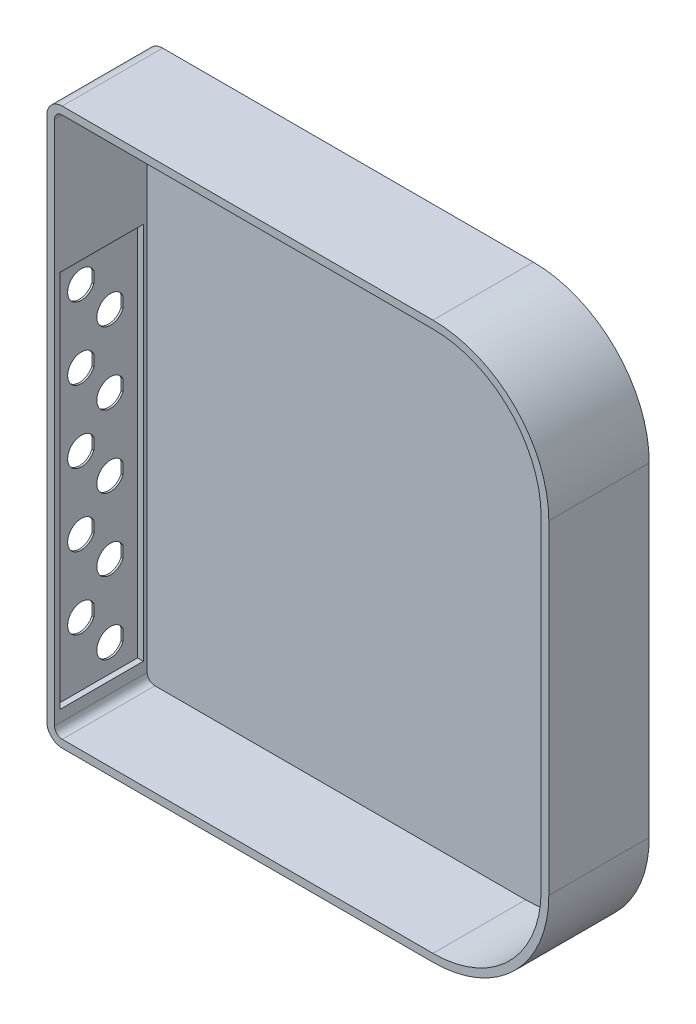
from build123d import *

# Parameters (mm, degrees)
BOSS_EXTRUDE1_DEPTH = 65
SHELL1_T            = -5
CUT_EXTRUDE1_DEPTH  = 373.86056375
SKETCH4_W           = 245
SKETCH4_H           = 53.856180832
CUT_EXTRUDE2_DEPTH  = 3.75


# Read off the part's stored shape, not the designer's step: Boss-Extrude1
with BuildPart() as part:
    # Boss-Extrude1 outline → Boss-Extrude1 (new body)
    with BuildSketch(Plane(origin=(0, 0, 0), x_dir=(0, 1, 0), z_dir=(0, 0, 1))):
        with BuildLine():
            ThreePointArc((105, -162.5), (158.033008589, -140.533008589), (180, -87.5))
            Line((180, -87.5), (180, 152.5))
            ThreePointArc((180, 152.5), (177.071067812, 159.571067812), (170, 162.5))
            Line((170, 162.5), (-170, 162.5))
            ThreePointArc((-170, 162.5), (-177.071067812, 159.571067812), (-180, 152.5))
            Line((-180, 152.5), (-180, -87.5))
            ThreePointArc((-180, -87.5), (-158.033008589, -140.533008589), (-105, -162.5))
            Line((-105, -162.5), (105, -162.5))
        make_face()
    extrude(amount=BOSS_EXTRUDE1_DEPTH)

    # Shell1
    shell1_openings = [part.faces().sort_by_distance(p)[0] for p in [
        (-3.011930619, 0, 65),
    ]]
    offset(amount=SHELL1_T, openings=shell1_openings, kind=Kind.INTERSECTION)

    # Sketch3 → Cut-Extrude1 (cut, through all)
    with BuildSketch(Plane.YZ.offset(-157.5)):
        with BuildLine():
            Line((-148.652392821, 16.9228), (-141.347607179, 16.9228))
            ThreePointArc((-141.347607179, 16.9228), (-145, 33.8646), (-148.652392821, 16.9228))
        make_face()
        with BuildLine():
            Line((-125.319059488, 35.778980832), (-118.014273846, 35.778980832))
            ThreePointArc((-118.014273846, 35.778980832), (-121.666666667, 52.720780832), (-125.319059488, 35.778980832))
        make_face()
        with BuildLine():
            Line((-78.652392821, 35.778980832), (-71.347607179, 35.778980832))
            ThreePointArc((-71.347607179, 35.778980832), (-75, 52.720780832), (-78.652392821, 35.778980832))
        make_face()
        with BuildLine():
            Line((-101.985726154, 16.9228), (-94.680940512, 16.9228))
            ThreePointArc((-94.680940512, 16.9228), (-98.333333333, 33.8646), (-101.985726154, 16.9228))
        make_face()
        with BuildLine():
            Line((-31.985726154, 35.778980832), (-24.680940512, 35.778980832))
            ThreePointArc((-24.680940512, 35.778980832), (-28.333333333, 52.720780832), (-31.985726154, 35.778980832))
        make_face()
        with BuildLine():
            Line((-55.319059488, 16.9228), (-48.014273846, 16.9228))
            ThreePointArc((-48.014273846, 16.9228), (-51.666666667, 33.8646), (-55.319059488, 16.9228))
        make_face()
        with BuildLine():
            Line((14.680940512, 35.778980832), (21.985726154, 35.778980832))
            ThreePointArc((21.985726154, 35.778980832), (18.333333333, 52.720780832), (14.680940512, 35.778980832))
        make_face()
        with BuildLine():
            Line((-8.652392821, 16.9228), (-1.347607179, 16.9228))
            ThreePointArc((-1.347607179, 16.9228), (-5, 33.8646), (-8.652392821, 16.9228))
        make_face()
        with BuildLine():
            Line((61.347607179, 35.778980832), (68.652392821, 35.778980832))
            ThreePointArc((68.652392821, 35.778980832), (65, 52.720780832), (61.347607179, 35.778980832))
        make_face()
        with BuildLine():
            Line((38.014273846, 16.9228), (45.319059488, 16.9228))
            ThreePointArc((45.319059488, 16.9228), (41.666666667, 33.8646), (38.014273846, 16.9228))
        make_face()
    extrude(amount=-CUT_EXTRUDE1_DEPTH, mode=Mode.SUBTRACT)

    # Sketch4 → Cut-Extrude2 (cut)
    with BuildSketch(Plane.YZ.offset(-157.5)):
        with Locations((-40, 34.428090416)):
            Rectangle(SKETCH4_W, SKETCH4_H)
    extrude(amount=-CUT_EXTRUDE2_DEPTH, mode=Mode.SUBTRACT)


solid = part.part
